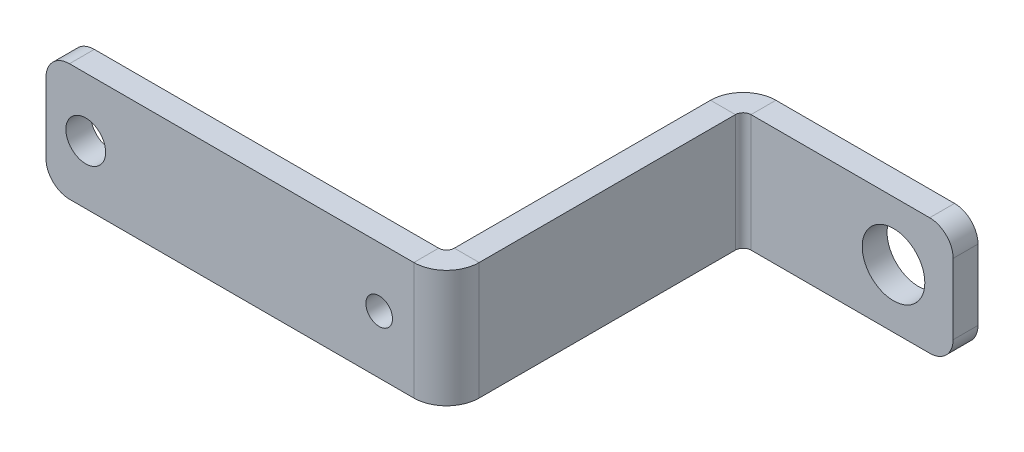
from build123d import *

# Parameters (mm, degrees)
SKETCH1_W                    = 48
SKETCH1_H                    = 15
BASE_FLANGE1_DEPTH           = 3.175
EDGE_FLANGE1_STRIP_W         = 14.7
EDGE_FLANGE1_STRIP_H         = 3.175
EDGE_FLANGE1_STRIP_CUT_DEPTH = 15
EDGE_FLANGE1_DEPTH           = 15
EDGE_FLANGE2_STRIP_W         = 14.7
EDGE_FLANGE2_STRIP_H         = 3.175
EDGE_FLANGE2_STRIP_CUT_DEPTH = 15
EDGE_FLANGE2_DEPTH           = 15
FILLET1_R                    = 3
SKETCH18_R                   = 2.54
CUT_EXTRUDE2_DEPTH           = 359.005866467
SKETCH19_R                   = 4
CUT_EXTRUDE3_DEPTH           = 358.655386406
M3_CLEARANCE_HOLE1_D         = 3.4


# Sheet-metal steps are written as plain solids
with BuildPart() as part:
    # Sketch1 → Base-Flange1 (new body)
    with BuildSketch(Plane.XY.offset(-1943.333434301)):
        with Locations((98.829284585, 313.628054742)):
            Rectangle(SKETCH1_W, SKETCH1_H)
    extrude(amount=BASE_FLANGE1_DEPTH)

    # Edge-Flange1 strip (across the edge) → Edge-Flange1 strip cut (cut)
    with BuildSketch(Plane(origin=(122.829284585, 321.128054742, -1943.333434301), x_dir=(-1, 0, 0), z_dir=(0, -1, 0))):
        with Locations((-6.35, -1.5875)):
            Rectangle(EDGE_FLANGE1_STRIP_W, EDGE_FLANGE1_STRIP_H)
    extrude(amount=EDGE_FLANGE1_STRIP_CUT_DEPTH, mode=Mode.SUBTRACT)

    # Edge-Flange1 section (across the edge) → Edge-Flange1 (add)
    with BuildSketch(Plane(origin=(122.829284585, 321.128054742, -1943.333434301), x_dir=(-1, 0, 0), z_dir=(0, -1, 0))):
        with BuildLine():
            Line((-3.175, 1), (-3.175, 34.7375))
            Line((-3.175, 34.7375), (0, 34.7375))
            Line((0, 34.7375), (0, 1))
            ThreePointArc((0, 1), (0.292893219, 0.292893219), (1, 0))
            Line((1, 0), (1, -3.175))
            ThreePointArc((1, -3.175), (-1.952170811, -1.952170811), (-3.175, 1))
        make_face()
    extrude(amount=EDGE_FLANGE1_DEPTH)

    # Edge-Flange2 strip (across the edge) → Edge-Flange2 strip cut (cut)
    with BuildSketch(Plane(origin=(126.004284585, 306.128054742, -1978.070934301), x_dir=(0, 0, 1), z_dir=(0, 1, 0))):
        with Locations((-6.35, -1.5875)):
            Rectangle(EDGE_FLANGE2_STRIP_W, EDGE_FLANGE2_STRIP_H)
    extrude(amount=EDGE_FLANGE2_STRIP_CUT_DEPTH, mode=Mode.SUBTRACT)

    # Edge-Flange2 section (across the edge) → Edge-Flange2 (add)
    with BuildSketch(Plane(origin=(126.004284585, 306.128054742, -1978.070934301), x_dir=(0, 0, 1), z_dir=(0, 1, 0))):
        with BuildLine():
            Line((-3.175, 1), (-3.175, 26.825))
            Line((-3.175, 26.825), (0, 26.825))
            Line((0, 26.825), (0, 1))
            ThreePointArc((0, 1), (0.292893219, 0.292893219), (1, 0))
            Line((1, 0), (1, -3.175))
            ThreePointArc((1, -3.175), (-1.952170811, -1.952170811), (-3.175, 1))
        make_face()
    extrude(amount=EDGE_FLANGE2_DEPTH)

    # Fillet1
    fillet1_edges = [part.edges().sort_by_distance(p)[0] for p in [
        (152.829284585, 306.128054742, -1979.658434301),
        (152.829284585, 321.128054742, -1979.658434301),
        (74.829284585, 306.128054742, -1941.745934301),
        (74.829284585, 321.128054742, -1941.745934301),
    ]]
    fillet(fillet1_edges, radius=FILLET1_R)

    # Sketch18 → Cut-Extrude2 (cut, through all)
    with BuildSketch(Plane.XY.offset(-1940.158434301)):
        with Locations((79.909284585, 313.628054742)):
            Circle(SKETCH18_R)
    extrude(amount=-CUT_EXTRUDE2_DEPTH, mode=Mode.SUBTRACT)

    # Sketch19 → Cut-Extrude3 (cut, through all)
    with BuildSketch(Plane.XY.offset(-1978.070934301)):
        with Locations((145.209284585, 313.628054742)):
            Circle(SKETCH19_R)
    extrude(amount=-CUT_EXTRUDE3_DEPTH, mode=Mode.SUBTRACT)

    # M3 Clearance Hole1 (through all)
    with Locations(Plane.XY.offset(-1940.158434301)):
        with Locations((117.404284585, 313.537425755)):
            Hole(M3_CLEARANCE_HOLE1_D / 2)


solid = part.part
